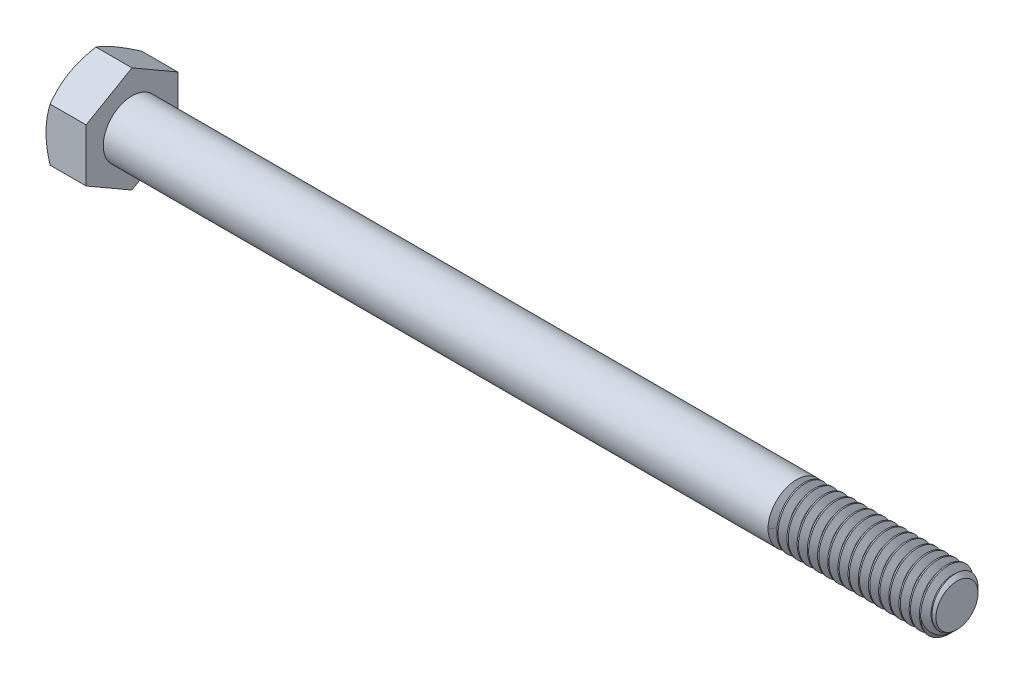
from build123d import *

# Parameters (mm, degrees)
SKETCH5_R           = 3.96875
BOSS_EXTRUDE3_DEPTH = 114.3
CHAMFER1_SIZE       = 1.058333333
BOSS_EXTRUDE4_DEPTH = 5.55625
SKETCH8_OUTSIDE_W   = 458.998
SKETCH8_OUTSIDE_H   = 460.962
SKETCH8_OUTSIDE_R   = 6.35
CUT_EXTRUDE3_DEPTH  = 121.248103924
CUT_EXTRUDE3_DRAFT  = -60
CUT_EXTRUDE4_DEPTH  = 0.254
CIRPATTERN1_COUNT   = 6
CUT_SWEEP1_PITCH    = 1.411111111
CUT_SWEEP1_TO       = 22.225


with BuildPart() as part:
    # Sketch5 → Boss-Extrude3 (new body)
    with BuildSketch(Plane(origin=(59.928125, 0, 0), x_dir=(0, 0, -1), z_dir=(1, 0, 0))):
        Circle(SKETCH5_R)
    extrude(amount=-BOSS_EXTRUDE3_DEPTH)

    # Chamfer1
    chamfer1_edges = [part.edges().sort_by_distance(p)[0] for p in [
        (59.928125, 0, 3.96875),
    ]]
    chamfer(chamfer1_edges, length=CHAMFER1_SIZE)

    # Sketch11 → Revolve1 (revolve)
    with BuildSketch(Plane.XY):
        Polygon((-54.371875, 3.96875), (-54.371875, 0), (41.671875, 0), (37.703125, 3.96875), align=None)
    revolve(axis=Axis((-54.371875, 0, 0), (1, 0, 0)))

    # Sketch6 → Boss-Extrude4 (add)
    with BuildSketch(Plane.ZY.offset(54.371875)):
        Polygon((6.35, 3.666174209), (0, 7.332348419), (-6.35, 3.666174209), (-6.35, -3.666174209), (0, -7.332348419), (6.35, -3.666174209), align=None)
    extrude(amount=BOSS_EXTRUDE4_DEPTH)


with BuildPart() as cut_extrude3_tool:
    # Sketch8 outside → Cut-Extrude3 (with draft: the straight prism first)
    with BuildSketch(Plane.ZY.offset(59.928125)):
        Rectangle(SKETCH8_OUTSIDE_W, SKETCH8_OUTSIDE_H)
        Circle(SKETCH8_OUTSIDE_R, mode=Mode.SUBTRACT)
    extrude(amount=-CUT_EXTRUDE3_DEPTH)
    # Cut-Extrude3: the draft: its side faces are tilted about the plane it starts from
    cut_extrude3_sides = [cut_extrude3_tool.faces().sort_by_distance(p)[0] for p in [
        (0.695926962, -230.481, 0),
        (0.695926962, 0, 229.499),
        (0.695926962, 230.481, 0),
        (0.695926962, 0, -229.499),
        (0.695926962, 0, -6.35),
    ]]
    draft(cut_extrude3_sides, Plane.ZY.offset(59.928125), CUT_EXTRUDE3_DRAFT)


with BuildPart() as part_1:
    add(part.part)

    # Cut-Extrude3: cut by cut_extrude3_tool
    add(cut_extrude3_tool.part, mode=Mode.SUBTRACT)

    # Sketch12 → Cut-Extrude4 (cut)
    with BuildSketch(Plane.ZY.offset(59.928125)):
        with BuildLine():
            Line((0.1905, 4.8895), (0.1905, 2.7305))
            ThreePointArc((0.1905, 2.7305), (0, 2.54), (-0.1905, 2.7305))
            Line((-0.1905, 2.7305), (-0.1905, 4.8895))
            ThreePointArc((-0.1905, 4.8895), (0, 5.08), (0.1905, 4.8895))
        make_face()
    cut_extrude4 = extrude(amount=-CUT_EXTRUDE4_DEPTH, mode=Mode.SUBTRACT)

    # CirPattern1: Cut-Extrude4 ×6 about axis
    cirpattern1_axis = Axis((0, 0, 0), (1, 0, 0))
    for i in range(1, CIRPATTERN1_COUNT):
        add(cut_extrude4.rotate(cirpattern1_axis, i * 360 / CIRPATTERN1_COUNT), mode=Mode.SUBTRACT)


with BuildPart() as body_2:
    # Split1: the piece on the far side of the plane
    add(part_1.part)
    split(bisect_by=Plane(origin=(37.703125, 0, 0), x_dir=(0, 0, 1), z_dir=(1, 0, 0)), keep=Keep.BOTTOM)


with BuildPart() as part_2:
    add(part_1.part)

    # Split1
    split(bisect_by=Plane(origin=(37.703125, 0, 0), x_dir=(0, 0, 1), z_dir=(1, 0, 0)), keep=Keep.TOP)

    # Cut-Sweep1: arcs per turn and ends read off the stored shape
    # Cut-Sweep1: the profile of Sketch10 profile screwed along a right-hand helix through 16.75 turns, 8 arcs to a turn; built about Z, then put on its axis
    cut_sweep1_z = Axis((0, 0, 0), (0, 0, 1))
    cut_sweep1_corners = [(3.96905, 0, 0.000173205), (3.052206448, 0, -0.529166667), (3.052206448, 0, -0.705555556), (3.96905, 0, -1.234895427)]
    with BuildLine(mode=Mode.PRIVATE) as cut_sweep1_profile:
        Line(cut_sweep1_corners[0], cut_sweep1_corners[1])
        Line(cut_sweep1_corners[1], cut_sweep1_corners[2])
        Line(cut_sweep1_corners[2], cut_sweep1_corners[3])
        Line(cut_sweep1_corners[3], cut_sweep1_corners[0])
    cut_sweep1_cap = Face(cut_sweep1_profile.wire())
    cut_sweep1_turn_angles = [0, 22.5, 45, 67.5, 90, 112.5, 135, 157.5, 180, 202.5, 225, 247.5, 270, 292.5, 315, 337.5, 360]
    cut_sweep1_turn_weights = [1, 0.9238795325112867, 1, 0.9238795325112867, 1, 0.9238795325112867, 1, 0.9238795325112867, 1, 0.9238795325112867, 1, 0.9238795325112867, 1, 0.9238795325112867, 1, 0.9238795325112867, 1]
    cut_sweep1_turn_rails = [Edge.make_bspline([Vector(p[0], p[1], 0).rotate(cut_sweep1_z, cut_sweep1_turn_angles[k]) / cut_sweep1_turn_weights[k] + Vector(0, 0, p[2] + CUT_SWEEP1_PITCH * cut_sweep1_turn_angles[k] / 360) for k in range(17)], [0, 0, 0, 1, 1, 2, 2, 3, 3, 4, 4, 5, 5, 6, 6, 7, 7, 8, 8, 8], 2, cut_sweep1_turn_weights) for p in cut_sweep1_corners]
    cut_sweep1_turn_sides = [Face.make_surface_from_curves(cut_sweep1_turn_rails[p[0]], cut_sweep1_turn_rails[p[1]]) for p in [(0, 1), (1, 2), (2, 3), (3, 0)]]
    cut_sweep1_last_angles = [5760, 5782.5, 5805, 5827.5, 5850, 5872.5, 5895, 5917.5, 5940, 5962.5, 5985, 6007.5, 6030]
    cut_sweep1_last_weights = [1, 0.9238795325112867, 1, 0.9238795325112867, 1, 0.9238795325112867, 1, 0.9238795325112867, 1, 0.9238795325112867, 1, 0.9238795325111319, 1]
    cut_sweep1_last_rails = [Edge.make_bspline([Vector(p[0], p[1], 0).rotate(cut_sweep1_z, cut_sweep1_last_angles[k]) / cut_sweep1_last_weights[k] + Vector(0, 0, p[2] + CUT_SWEEP1_PITCH * cut_sweep1_last_angles[k] / 360) for k in range(13)], [0, 0, 0, 1, 1, 2, 2, 3, 3, 4, 4, 5, 5, 6, 6, 6], 2, cut_sweep1_last_weights) for p in cut_sweep1_corners]
    cut_sweep1_last_sides = [Face.make_surface_from_curves(cut_sweep1_last_rails[p[0]], cut_sweep1_last_rails[p[1]]) for p in [(0, 1), (1, 2), (2, 3), (3, 0)]]
    cut_sweep1 = Plane(origin=(59.928125, 0, 0), x_dir=(0, 1, 0), z_dir=(-1, 0, 0)) * split(Solid(Shell([*[p.moved(Location((0, 0, CUT_SWEEP1_PITCH * i))) for i in range(16) for p in cut_sweep1_turn_sides], *cut_sweep1_last_sides, cut_sweep1_cap, cut_sweep1_cap.rotate(cut_sweep1_z, 6030).moved(Location((0, 0, CUT_SWEEP1_PITCH * 6030 / 360)))])), bisect_by=Plane.XY.offset(CUT_SWEEP1_TO), keep=Keep.BOTTOM, mode=Mode.PRIVATE)
    add(cut_sweep1, mode=Mode.SUBTRACT)

    add(body_2.part)  # Boss-Extrude5 merges body 2
    # Boss-Extrude5: read off the stored shape, not the designer's step
    # Boss-Extrude5 outline → Boss-Extrude5 (revolve)
    with BuildSketch(Plane.YX):
        Polygon((3.96875, 37.703125), (3.052197263, 38.232296969), (3.052197263, 37.703125), align=None)
    revolve(axis=Axis((0, 0, 0), (1, 0, 0)))


solid = part_2.part
